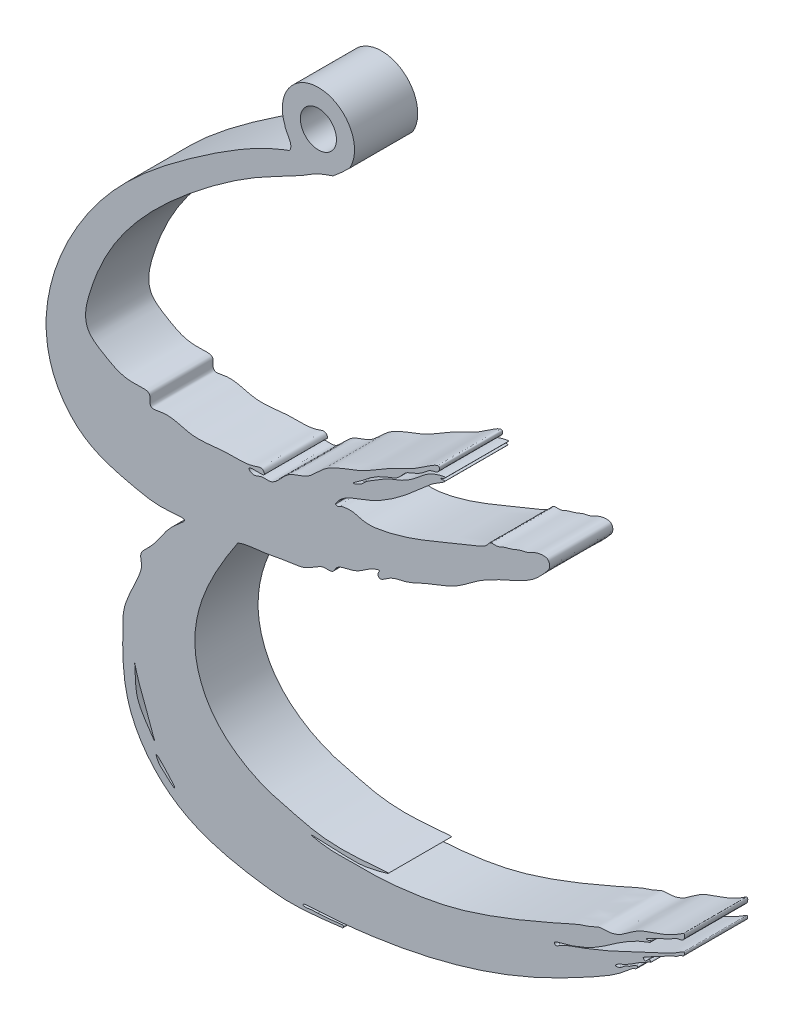
from build123d import *

# Parameters (mm, degrees)
BOSS_EXTRU_1_DEPTH = 7
ESQUISSE2_R        = 2
BOSS_EXTRU_2_DEPTH = 7


# Read off the part's stored shape, not the designer's step: Boss.-Extru.1
with BuildPart() as part:
    # Boss.-Extru.1 outline → Boss.-Extru.1 (new body)
    with BuildSketch(Plane.XY):
        with BuildLine():
            add(Edge.make_bspline(
                [(96.928639674, 44.612990306), (96.931348535, 44.61743058), (96.992220422, 44.717483854), (97.134319843, 44.965830557), (96.800953135, 44.646037976), (96.454896019, 44.748420478), (97.784245167, 45.489490753), (98.698027492, 45.705035812), (99.960087035, 46.578237992), (100.756901067, 46.53778465), (100.781008582, 47.443539083), (99.590368465, 46.627839995), (98.064604318, 45.934514855), (94.936348166, 45.035728658), (93.526818148, 43.264064204), (91.827851875, 43.31211295), (91.066044853, 43.223020219), (90.462862775, 42.838821103), (89.189576441, 42.467760541), (86.978980068, 41.481009242), (77.792430516, 37.327222828), (70.571879283, 36.105591432), (66.483156504, 35.736763188), (63.360145867, 35.830064634), (61.550624855, 35.708549748), (58.005123835, 36.351577033), (64.126920687, 35.901690054), (65.575743354, 36.088890748), (69.144387753, 36.993003878), (61.301921296, 36.047907912), (58.717121757, 36.983451614), (53.531439105, 38.207261893), (48.389844105, 41.103191825), (44.946181563, 50.075354707), (49.042196172, 56.711097348), (51.276591432, 60.106669295)],
                knots=[0, 0, 0, 0, 0.000429019, 0.009650395, 0.023053151, 0.030558807, 0.037160308, 0.150591667, 0.180561139, 0.209151123, 0.228766878, 0.23568291, 0.348381373, 0.450862455, 0.591404861, 0.605270559, 0.60809271, 0.618344856, 0.620639113, 0.629753762, 0.666113158, 0.682542369, 0.692714883, 0.699913723, 0.707224892, 0.710570795, 0.72062686, 0.729613338, 0.73334422, 0.741972052, 0.764034957, 0.768567616, 0.78729865, 0.803416924, 0.837535097, 0.837535097, 0.837535097, 0.837535097], degree=3))
            add(Edge.make_bspline(
                [(51.276591432, 60.106669295), (52.216980221, 60.468204781), (54.036488505, 60.516733959), (56.518169343, 61.097330671), (58.666107752, 61.234058355), (59.897421532, 62.172517135), (60.875204734, 62.621131341), (61.816106094, 62.40670181), (62.213745329, 63.427368193), (63.392349772, 63.642149599), (64.535879757, 63.975064601), (65.546579301, 64.692432839), (66.094246456, 65.066965425), (67.203799293, 65.44202635), (66.707348415, 64.939276436), (66.99707579, 64.294773963), (68.26888199, 65.447991059), (69.872045965, 65.509403532), (72.357519349, 66.856692835), (75.341757353, 67.70322766), (78.209075496, 70.216585969), (81.335720432, 71.520295206), (83.990866363, 72.794303181), (85.156981802, 74.096041611), (85.915488715, 74.936685433), (85.690204819, 75.791391192), (84.902702789, 75.833464537), (84.144098787, 75.664413214), (83.445459532, 75.194773572), (82.479317322, 75.081823931), (81.691339066, 74.647690273), (80.722812466, 74.476177328), (80.036508054, 74.027333517), (79.227712115, 74.230034042), (78.786428608, 73.505511236), (77.147155208, 72.778467696), (74.637380311, 71.806222127), (71.088722647, 70.306994321), (68.236061985, 69.40505622), (65.987440531, 69.081880742), (64.986550037, 69.157713977), (64.086942967, 69.491782556), (63.365896805, 69.447887681), (62.713323461, 69.368496044), (62.435205932, 69.095571898), (62.055175557, 69.185608407), (62.143176319, 69.331512288), (62.775040386, 70.460909172), (66.204568141, 71.331656221), (69.239743206, 73.415776853), (71.545782642, 75.420436232), (72.702045921, 76.514249279), (73.59113028, 77.002420284), (73.953660902, 77.238497934), (74.265155827, 77.505693526), (73.966493819, 77.533150568), (73.758958076, 77.42262215), (73.789331953, 77.565073937)],
                knots=[0, 0, 0, 0, 0.037311063, 0.067132613, 0.096053061, 0.115115707, 0.123614159, 0.136472615, 0.143884529, 0.159430477, 0.17682514, 0.190211299, 0.202319092, 0.209924827, 0.2151689, 0.21873374, 0.232064776, 0.257242232, 0.286307386, 0.33290807, 0.373258478, 0.42579287, 0.460063918, 0.480885925, 0.492042326, 0.499948532, 0.507555739, 0.517950483, 0.529650548, 0.537979896, 0.553818863, 0.56271552, 0.574430158, 0.583715412, 0.588441224, 0.603705009, 0.649187876, 0.690357062, 0.747621403, 0.760550546, 0.775211358, 0.78469278, 0.795926457, 0.802181515, 0.808231098, 0.810729679, 0.811964275, 0.813512594, 0.861480588, 0.925965587, 0.956206121, 0.974515004, 0.986662787, 0.991349587, 0.994374231, 0.996165229, 1, 1, 1, 1], degree=3))
            add(Edge.make_bspline(
                [(73.789331953, 77.565073937), (74.042416082, 77.681545368), (74.047966093, 77.609695571), (74.317065215, 77.913962168), (72.327770311, 77.599072059), (71.398708217, 76.298733484), (69.347072463, 75.088701998), (67.750793048, 74.594952327), (66.644932028, 73.774334298), (65.419013437, 73.121537192), (64.997276547, 72.502205793), (63.652418993, 72.040667611), (65.102878812, 72.974625252), (65.916278947, 73.743582248), (67.520969482, 74.654717604), (69.063520178, 75.080931917), (69.750841917, 76.176251109), (70.869143678, 76.542949537), (71.839936631, 77.062522847), (72.577596305, 77.846873017), (73.488228472, 77.827448911), (73.745565879, 79.037481857), (70.596133623, 76.663623867), (68.497982927, 76.074077263), (64.739495435, 73.465036348), (61.076118313, 72.649309766), (59.10783231, 70.066102878), (56.513861099, 69.734802708), (55.410445424, 67.546338123), (53.789172583, 67.906167629), (53.021817579, 67.269511189), (52.244596536, 68.025042657), (53.378430803, 68.035405436), (54.40330904, 67.955381421), (53.96061894, 68.718854533), (52.399562161, 68.021959249), (49.926974862, 68.339855227), (46.148778935, 67.495486664), (43.724709052, 68.779335617), (41.587159777, 68.090301659), (41.492896508, 68.894819432), (41.631351699, 69.852494879), (38.819041531, 69.411832052), (37.008997243, 70.440835529), (33.90935757, 72.265062261), (35.317871424, 78.191629209), (39.198129191, 85.177417584), (46.739329868, 91.878643324), (53.445888591, 96.450326425), (58.23409934, 98.689539665), (60.189910863, 100.081846894), (62.728928685, 100.785873934), (59.533751734, 100.556708181), (58.28993961, 100.535528867), (57.192127023, 100.684755052), (53.159643714, 99.145568567), (45.148644083, 94.028886119), (33.392518449, 84.616208708), (27.674074354, 68.864740227), (34.381023547, 60.959613386), (39.762888978, 59.738958909), (42.431138258, 59.138312739), (45.898405123, 59.576989229), (43.925419875, 58.075433902), (42.922225484, 56.735917623), (41.732409114, 54.934679109), (40.257681752, 53.745653492), (40.721309914, 52.715194763), (40.093779777, 50.61293915), (38.530210307, 48.239788292), (38.516739884, 43.646438433), (38.459110579, 38.057053654), (43.987147824, 30.788362062), (51.12489316, 29.089734808), (57.440656564, 28.285983643), (60.647338389, 28.726614164), (62.660916625, 28.965827863)],
                knots=[0, 0, 0, 0, 0.001737315, 0.002494157, 0.003123887, 0.020372956, 0.027754214, 0.032938611, 0.042064874, 0.045791887, 0.050242228, 0.053392936, 0.057155506, 0.063343778, 0.072457358, 0.079357305, 0.083574067, 0.08834131, 0.094191048, 0.097815136, 0.10222564, 0.103324234, 0.111686636, 0.128613966, 0.14671854, 0.165606577, 0.176758998, 0.186161811, 0.197939909, 0.201137288, 0.20652587, 0.208033129, 0.211848088, 0.215663046, 0.217216693, 0.220425155, 0.234079166, 0.251949087, 0.266721955, 0.271251575, 0.273708107, 0.275573244, 0.282889663, 0.297974024, 0.307836209, 0.324630906, 0.36491309, 0.417495288, 0.450972474, 0.472882612, 0.482533459, 0.487242415, 0.496684655, 0.503495759, 0.508291827, 0.509976994, 0.559555427, 0.630289728, 0.711218462, 0.733900446, 0.757756542, 0.776204068, 0.781893341, 0.786182077, 0.798396567, 0.808520406, 0.814174843, 0.81982731, 0.823005041, 0.843402466, 0.849459629, 0.881026998, 0.916506526, 0.958241489, 0.973312959, 1, 1, 1, 1], degree=3))
            add(Edge.make_bspline(
                [(62.660916625, 28.965827863), (62.811167307, 28.965827863), (62.905432063, 28.953909338), (63.014774528, 29.193478452), (62.857529902, 29.274035986), (61.950979059, 29.100645201), (60.171031326, 29.015082665), (60.159242771, 29.025928135)],
                knots=[0, 0, 0, 0, 0.082506092, 0.133215227, 0.174158315, 0.210899239, 1, 1, 1, 1], degree=3))
            add(Edge.make_bspline(
                [(60.159242771, 29.025928135), (59.915262646, 28.997776582), (59.266044746, 29.034548717), (58.821343654, 28.848845923), (58.41907585, 28.989089095), (58.626662699, 29.145227327), (58.794072762, 29.176875555), (60.330294635, 29.24361134), (68.058308564, 29.769830566), (79.113479492, 32.201926422), (88.927559961, 37.158821747), (93.208226738, 39.613140709), (94.552422928, 40.785958325), (95.047284276, 41.214625016), (95.4734822, 41.28288545), (95.584675024, 41.633362594), (95.173572129, 41.61925477), (94.839928194, 41.197242475), (93.982893704, 40.950612564), (93.687218593, 40.496500456), (93.014223233, 40.394741966), (93.2756311, 40.732802138), (93.92157824, 40.972107633), (94.929780401, 41.512459476), (95.781987939, 42.175664859), (96.49475337, 42.429512728), (96.733725873, 42.687351989), (97.134858059, 42.748322481), (96.843234671, 42.957517046), (96.606773225, 42.777385283), (96.410625955, 42.487553029), (96.059069947, 42.758793556), (96.481267932, 42.96176623), (96.999215535, 43.310082763), (98.053488445, 43.73771219), (99.004200548, 44.454379743), (99.895265436, 44.686597717), (100.310973938, 45.113858227), (100.741751864, 45.115422318), (100.759032776, 45.662374946), (99.426199606, 44.771231003), (97.338075386, 43.896426386), (93.315288021, 41.889538017), (89.909705124, 40.462941016), (87.540460503, 39.685031029), (86.8136768, 39.235592787), (86.469430376, 39.033230078), (86.200555666, 39.401779261), (92.183697835, 40.786985621), (92.474746098, 43.002852793), (96.928639674, 44.612990306)],
                knots=[0, 0, 0, 0, 0.011418307, 0.018667574, 0.020529834, 0.022064641, 0.025469056, 0.027447987, 0.07667142, 0.308023088, 0.426094838, 0.474335905, 0.484804499, 0.490684236, 0.497714744, 0.499162532, 0.500815925, 0.508783415, 0.519536312, 0.529047975, 0.53249919, 0.534050857, 0.541052094, 0.559421303, 0.573486851, 0.580904776, 0.584897346, 0.587944165, 0.589695995, 0.59401357, 0.597250921, 0.600633747, 0.603087148, 0.610231558, 0.626251653, 0.641928141, 0.653415198, 0.65836965, 0.662760573, 0.666806825, 0.669254499, 0.707798977, 0.765322389, 0.821932485, 0.845819623, 0.851361228, 0.855398361, 0.856965763, 0.865152421, 1, 1, 1, 1], degree=3))
        make_face()
        with BuildLine():
            add(Edge.make_bspline(
                [(42.232780417, 35.274043594), (42.215487838, 35.219163064), (42.458085816, 34.606690052), (42.917386156, 34.172360886), (43.619535868, 33.548306107), (43.926956371, 33.313795817), (44.280857892, 33.021078338), (44.245875104, 33.253233552), (44.139507531, 33.39673799), (43.874759153, 33.682603297), (43.417920482, 34.182732369), (43.040664246, 34.624546917), (42.263722772, 35.372243681), (42.232780417, 35.274043594)],
                knots=[0, 0, 0, 0, 0.066804931, 0.227094232, 0.379290435, 0.471780844, 0.501895024, 0.514205071, 0.563001344, 0.597809089, 0.704980754, 0.880463071, 1, 1, 1, 1], degree=3))
        make_face(mode=Mode.SUBTRACT)
        with BuildLine():
            add(Edge.make_bspline(
                [(41.86843313, 37.01718254), (41.223428004, 38.985235792), (40.324308297, 40.863157715), (39.844620709, 42.88713557)],
                knots=[0, 0, 0, 0, 1, 1, 1, 1], degree=3))
            add(Edge.make_bspline(
                [(39.844620709, 42.88713557), (39.951176363, 40.662280298), (39.979883213, 39.684961939), (40.937938854, 38.03370741), (41.930584763, 36.627768647), (42.073000463, 36.447064994), (42.04663005, 36.656713767), (42.040993264, 36.624425755), (41.951808567, 36.780686269), (41.917155242, 36.851047441), (41.86843313, 37.01718254)],
                knots=[0, 0, 0, 0, 0.530749994, 0.866803679, 0.910185139, 0.922557882, 0.935228607, 0.965644513, 0.972121652, 1, 1, 1, 1], degree=3))
        make_face(mode=Mode.SUBTRACT)
    extrude(amount=BOSS_EXTRU_1_DEPTH)

    # Esquisse2 → Boss.-Extru.2 (add)
    with BuildSketch(Plane.XY.offset(7)):
        with BuildLine():
            Line((56.834822705, 100.543651775), (61.810793097, 100.577097676))
            add(Edge.make_bspline(
                [(61.810793097, 100.577097676), (62.771179761, 101.347938865), (63.639782101, 102.221584525)],
                knots=[0, 0, 0, 1, 1, 1], degree=2))
            ThreePointArc((63.639782101, 102.221584525), (60.503657223, 108.241328889), (56.476428325, 102.777444843))
            add(Edge.make_bspline(
                [(56.476428325, 102.777444843), (56.569498504, 102.155510493), (57.409260955, 101.477082211), (57.018388416, 100.549465225), (56.834822705, 100.543651775)],
                knots=[0, 0, 0, 0, 0.800674483, 1, 1, 1, 1], degree=3))
        make_face()
        with Locations((60.194196418, 104.253317603)):
            Circle(ESQUISSE2_R, mode=Mode.SUBTRACT)
    extrude(amount=-BOSS_EXTRU_2_DEPTH)


solid = part.part
